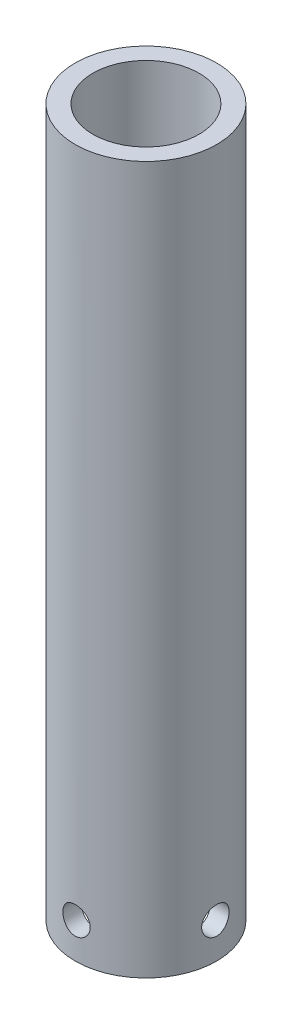
from build123d import *

# Parameters (mm, degrees)
SKETCH1_R          = 12.7
SKETCH1_R_2        = 9.525
ELTUBO_DEPTH       = 127
SETSCREW_OUTLINE_W = 2.45745
SETSCREW_OUTLINE_H = 3.497687322
CIRPATTERN1_COUNT  = 4


# Read off the part's stored shape, not the designer's step: SetScrew
with BuildPart() as part:
    # Sketch1 → ElTubo (new body)
    with BuildSketch(Plane(origin=(0, 0, 0), x_dir=(1, 0, 0), z_dir=(0, 1, 0))):
        with Locations(Location((0, 0, 0), (0, 0, 270))):
            Circle(SKETCH1_R)
        with Locations(Location((0, 0, 0), (0, 0, 270))):
            Circle(SKETCH1_R_2, mode=Mode.SUBTRACT)
    extrude(amount=ELTUBO_DEPTH)

    # SetScrew outline → SetScrew (revolve, cut)
    with BuildSketch(Plane(origin=(0, 6.35, 0), x_dir=(0, 1, 0), z_dir=(0, 0, -1))):
        with Locations((1.228725, -10.951191646)):
            Rectangle(SETSCREW_OUTLINE_W, SETSCREW_OUTLINE_H)
    setscrew = revolve(axis=Axis((0, 6.35, 0), (1, 0, 0)), mode=Mode.SUBTRACT)

    # CirPattern1: SetScrew ×4 about axis
    cirpattern1_axis = Axis((0, 127, 0), (0, -1, 0))
    for i in range(1, CIRPATTERN1_COUNT):
        add(setscrew.rotate(cirpattern1_axis, i * 360 / CIRPATTERN1_COUNT), mode=Mode.SUBTRACT)


solid = part.part
